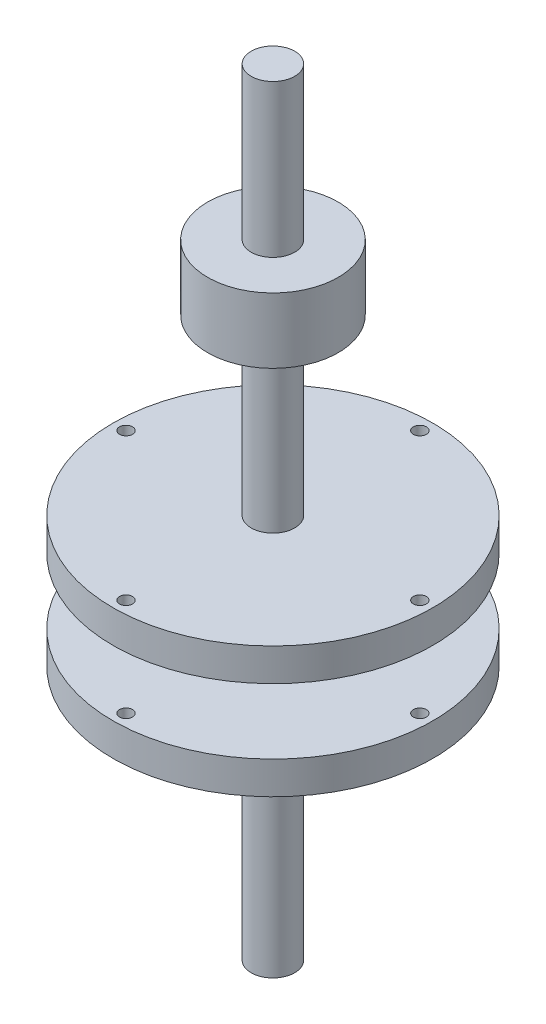
from build123d import *

# Parameters (mm, degrees)
SKETCH2_R          = 3
CUT_EXTRUDE1_DEPTH = 80


with BuildPart() as part:
    # Sketch1 → Revolve3 (revolve)
    with BuildSketch(Plane.XY):
        Polygon((0, -178.35475), (10, -178.35475), (10, -61.35475), (73.5, -61.35475), (73.5, -46.35475), (10, -46.35475), (10, -16.35475), (73.5, -16.35475), (73.5, -1.35475), (10, -1.35475), (10, 78.35475), (30, 78.35475), (30, 108.35475), (10, 108.35475), (10, 178.35475), (0, 178.35475), align=None)
    revolve(axis=Axis((0, 223.956756344, 0), (0, -1, 0)))

    # Sketch2 → Cut-Extrude1 (cut)
    with BuildSketch(Plane.XZ.offset(61.35475)):
        with Locations((67.5, 0)):
            Circle(SKETCH2_R)
        with Locations((-67.5, 0)):
            Circle(SKETCH2_R)
        with Locations((0, 67.5)):
            Circle(SKETCH2_R)
        with Locations((0, -67.5)):
            Circle(SKETCH2_R)
    extrude(amount=-CUT_EXTRUDE1_DEPTH, mode=Mode.SUBTRACT)


solid = part.part
